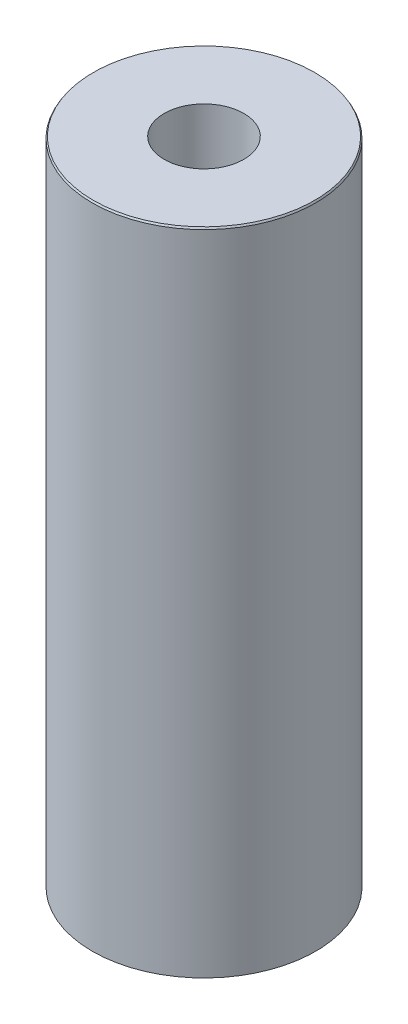
from build123d import *
from OCP.BRepFilletAPI import BRepFilletAPI_MakeChamfer

# Parameters (mm, degrees)
SKETCH1_R           = 52.5
BOSS_EXTRUDE1_DEPTH = 305.770544255
SKETCH2_R           = 18.717357424
CUT_EXTRUDE1_DEPTH  = 315.655566825
CHAMFER1_SIZE       = 0.816329508
CHAMFER1_SIZE2      = 0.471308061


with BuildPart() as part:
    # Sketch1 → Boss-Extrude1 (new body)
    with BuildSketch(Plane(origin=(0, 0, 0), x_dir=(1, 0, 0), z_dir=(0, 1, 0))):
        Circle(SKETCH1_R)
    extrude(amount=BOSS_EXTRUDE1_DEPTH)

    # Sketch2 → Cut-Extrude1 (cut, through all)
    with BuildSketch(Plane(origin=(0, 0, 0), x_dir=(1, 0, 0), z_dir=(0, 1, 0))):
        Circle(SKETCH2_R)
    extrude(amount=CUT_EXTRUDE1_DEPTH, mode=Mode.SUBTRACT)

    # Chamfer1: one chamfer whose edges measure the first distance from different faces: ONE call of the kernel's chamfer builder (chamfer() names one face for all edges)
    chamfer1_edges_1 = [part.edges().sort_by_distance(p)[0] for p in [
        (-52.5, 305.770544255, 0),
    ]]
    chamfer1_side_1 = [part.faces().sort_by_distance(p)[0] for p in [
        (-52.5, 152.885272127, 0),
    ]]
    chamfer1_edges_2 = [part.edges().sort_by_distance(p)[0] for p in [
        (-52.5, 0, 0),
    ]]
    chamfer1_side_2 = [part.faces().sort_by_distance(p)[0] for p in [
        (-51.01507576, 0, 0),
    ]]
    chamfer1 = BRepFilletAPI_MakeChamfer(part.part.solid().wrapped)
    for e in chamfer1_edges_1:
        chamfer1.Add(CHAMFER1_SIZE, CHAMFER1_SIZE2, e.wrapped, chamfer1_side_1[0].wrapped)  # the first distance lies on this face
    for e in chamfer1_edges_2:
        chamfer1.Add(CHAMFER1_SIZE, CHAMFER1_SIZE2, e.wrapped, chamfer1_side_2[0].wrapped)  # the first distance lies on this face
    add(Compound.cast(chamfer1.Shape()), mode=Mode.REPLACE)


solid = part.part
